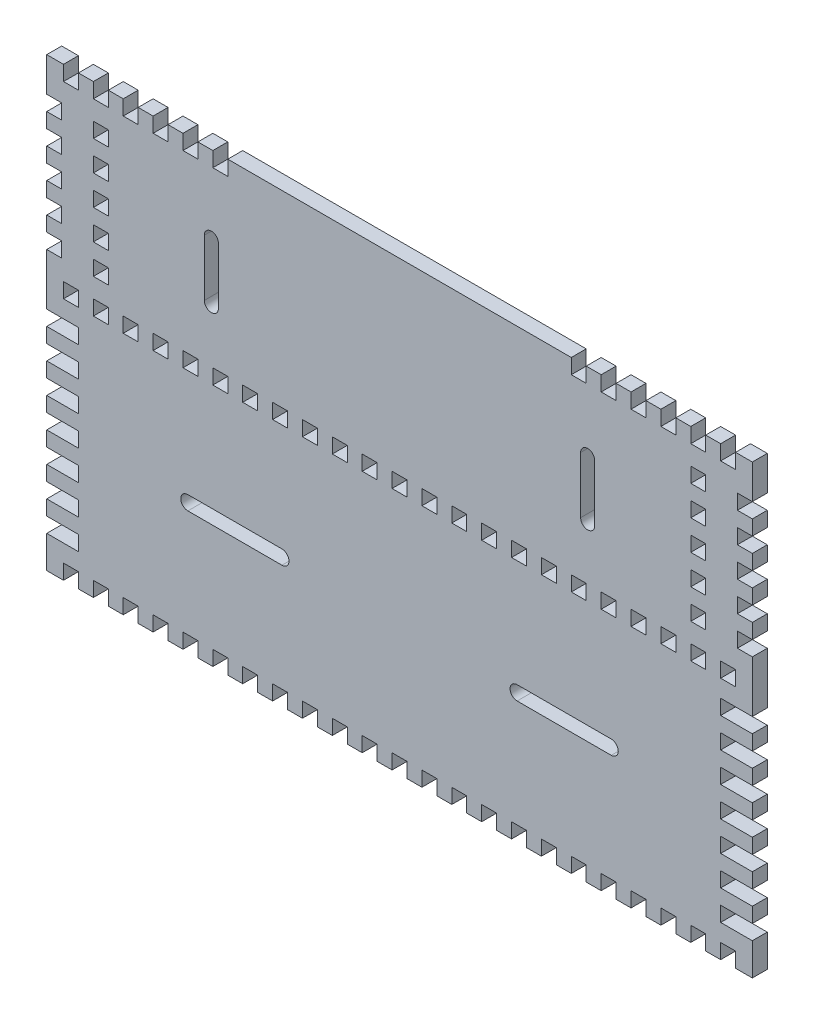
from build123d import *

# Parameters (mm, degrees)
SKETCH1_W                = 150
SKETCH1_H                = 55
BOSS_EXTRUDE1_DEPTH      = 3.175
CUT_EXTRUDE1_REACH       = 81.946
SKETCH2_W                = 3.175
SKETCH2_H                = 6.35
LPATTERN1_COUNT          = 12
LPATTERN1_PITCH          = 6.35
LPATTERN1_COL_COUNT      = 12
LPATTERN1_COL_PITCH      = 6.35
MIRROR1_COPY_1_REACH     = 81.946
MIRROR1_COPY_1_SKETCH_W  = 3.175
MIRROR1_COPY_1_SKETCH_H  = 6.35
MIRROR1_COPY_2_REACH     = 81.946
MIRROR1_COPY_2_SKETCH_W  = 3.175
MIRROR1_COPY_2_SKETCH_H  = 6.35
MIRROR1_COPY_3_REACH     = 81.946
MIRROR1_COPY_3_SKETCH_W  = 3.175
MIRROR1_COPY_3_SKETCH_H  = 6.35
MIRROR1_COPY_4_REACH     = 81.946
MIRROR1_COPY_4_SKETCH_W  = 3.175
MIRROR1_COPY_4_SKETCH_H  = 6.35
MIRROR1_COPY_5_REACH     = 81.946
MIRROR1_COPY_5_SKETCH_W  = 3.175
MIRROR1_COPY_5_SKETCH_H  = 6.35
MIRROR1_COPY_6_REACH     = 81.946
MIRROR1_COPY_6_SKETCH_W  = 3.175
MIRROR1_COPY_6_SKETCH_H  = 6.35
MIRROR1_COPY_7_REACH     = 81.946
MIRROR1_COPY_7_SKETCH_W  = 3.175
MIRROR1_COPY_7_SKETCH_H  = 6.35
MIRROR1_COPY_8_REACH     = 81.946
MIRROR1_COPY_8_SKETCH_W  = 3.175
MIRROR1_COPY_8_SKETCH_H  = 6.35
MIRROR1_COPY_9_REACH     = 81.946
MIRROR1_COPY_9_SKETCH_W  = 3.175
MIRROR1_COPY_9_SKETCH_H  = 6.35
MIRROR1_COPY_10_REACH    = 81.946
MIRROR1_COPY_10_SKETCH_W = 3.175
MIRROR1_COPY_10_SKETCH_H = 6.35
MIRROR1_COPY_11_REACH    = 81.946
MIRROR1_COPY_11_SKETCH_W = 3.175
MIRROR1_COPY_11_SKETCH_H = 6.35
MIRROR1_COPY_12_REACH    = 81.946
MIRROR1_COPY_12_SKETCH_W = 3.175
MIRROR1_COPY_12_SKETCH_H = 6.35
MIRROR1_COPY_13_REACH    = 81.946
MIRROR1_COPY_13_SKETCH_W = 3.175
MIRROR1_COPY_13_SKETCH_H = 6.35
MIRROR1_COPY_14_REACH    = 81.946
MIRROR1_COPY_14_SKETCH_W = 3.175
MIRROR1_COPY_14_SKETCH_H = 6.35
MIRROR1_COPY_15_REACH    = 81.946
MIRROR1_COPY_15_SKETCH_W = 3.175
MIRROR1_COPY_15_SKETCH_H = 6.35
MIRROR1_COPY_16_REACH    = 81.946
MIRROR1_COPY_16_SKETCH_W = 3.175
MIRROR1_COPY_16_SKETCH_H = 6.35
MIRROR1_COPY_17_REACH    = 81.946
MIRROR1_COPY_17_SKETCH_W = 3.175
MIRROR1_COPY_17_SKETCH_H = 6.35
MIRROR1_COPY_18_REACH    = 81.946
MIRROR1_COPY_18_SKETCH_W = 3.175
MIRROR1_COPY_18_SKETCH_H = 6.35
MIRROR1_COPY_19_REACH    = 81.946
MIRROR1_COPY_19_SKETCH_W = 3.175
MIRROR1_COPY_19_SKETCH_H = 6.35
MIRROR1_COPY_20_REACH    = 81.946
MIRROR1_COPY_20_SKETCH_W = 3.175
MIRROR1_COPY_20_SKETCH_H = 6.35
MIRROR1_COPY_21_REACH    = 81.946
MIRROR1_COPY_21_SKETCH_W = 3.175
MIRROR1_COPY_21_SKETCH_H = 6.35
MIRROR1_COPY_22_REACH    = 81.946
MIRROR1_COPY_22_SKETCH_W = 3.175
MIRROR1_COPY_22_SKETCH_H = 6.35
SKETCH5_W                = 6.35
SKETCH5_H                = 3.175
CUT_EXTRUDE3_DEPTH       = 10
LPATTERN2_COUNT          = 4
LPATTERN2_PITCH          = 6.35
LPATTERN2_COL_COUNT      = 4
LPATTERN2_COL_PITCH      = 6.35
MIRROR2_COPY_1_SKETCH_W  = 6.35
MIRROR2_COPY_1_SKETCH_H  = 3.175
MIRROR2_COPY_1_DEPTH     = 10
MIRROR2_COPY_2_SKETCH_W  = 6.35
MIRROR2_COPY_2_SKETCH_H  = 3.175
MIRROR2_COPY_2_DEPTH     = 10
MIRROR2_COPY_3_SKETCH_W  = 6.35
MIRROR2_COPY_3_SKETCH_H  = 3.175
MIRROR2_COPY_3_DEPTH     = 10
MIRROR2_COPY_4_SKETCH_W  = 6.35
MIRROR2_COPY_4_SKETCH_H  = 3.175
MIRROR2_COPY_4_DEPTH     = 10
MIRROR2_COPY_5_SKETCH_W  = 6.35
MIRROR2_COPY_5_SKETCH_H  = 3.175
MIRROR2_COPY_5_DEPTH     = 10
MIRROR2_COPY_6_SKETCH_W  = 6.35
MIRROR2_COPY_6_SKETCH_H  = 3.175
MIRROR2_COPY_6_DEPTH     = 10
SKETCH7_W                = 3.175
SKETCH7_H                = 3.175
CUT_EXTRUDE5_DEPTH       = 10
LPATTERN4_COUNT          = 7
LPATTERN4_PITCH          = 6.35
MIRROR3_COPY_1_SKETCH_W  = 3.175
MIRROR3_COPY_1_SKETCH_H  = 3.175
MIRROR3_COPY_1_DEPTH     = 10
MIRROR3_COPY_2_SKETCH_W  = 3.175
MIRROR3_COPY_2_SKETCH_H  = 3.175
MIRROR3_COPY_2_DEPTH     = 10
MIRROR3_COPY_3_SKETCH_W  = 3.175
MIRROR3_COPY_3_SKETCH_H  = 3.175
MIRROR3_COPY_3_DEPTH     = 10
MIRROR3_COPY_4_SKETCH_W  = 3.175
MIRROR3_COPY_4_SKETCH_H  = 3.175
MIRROR3_COPY_4_DEPTH     = 10
MIRROR3_COPY_5_SKETCH_W  = 3.175
MIRROR3_COPY_5_SKETCH_H  = 3.175
MIRROR3_COPY_5_DEPTH     = 10
MIRROR3_COPY_6_SKETCH_W  = 3.175
MIRROR3_COPY_6_SKETCH_H  = 3.175
MIRROR3_COPY_6_DEPTH     = 10
CUT_EXTRUDE6_DEPTH       = 10
SKETCH9_W                = 150
SKETCH9_H                = 40
BOSS_EXTRUDE2_DEPTH      = 3.175
CUT_EXTRUDE8_DEPTH       = 10
LPATTERN5_COUNT          = 12
LPATTERN5_PITCH          = 6.35
LPATTERN5_COL_COUNT      = 12
LPATTERN5_COL_PITCH      = 6.35
SKETCH12_W               = 73.025
SKETCH12_H               = 3.175
BOSS_EXTRUDE3_DEPTH      = 3.175
SKETCH14_W               = 6.35
SKETCH14_H               = 3.175
CUT_EXTRUDE9_DEPTH       = 10
LPATTERN6_COUNT          = 3
LPATTERN6_PITCH          = 6.35
LPATTERN6_COL_COUNT      = 3
LPATTERN6_COL_PITCH      = 6.35
MIRROR4_COPY_1_SKETCH_W  = 6.35
MIRROR4_COPY_1_SKETCH_H  = 3.175
MIRROR4_COPY_1_DEPTH     = 10
MIRROR4_COPY_2_SKETCH_W  = 6.35
MIRROR4_COPY_2_SKETCH_H  = 3.175
MIRROR4_COPY_2_DEPTH     = 10
MIRROR4_COPY_3_SKETCH_W  = 6.35
MIRROR4_COPY_3_SKETCH_H  = 3.175
MIRROR4_COPY_3_DEPTH     = 10
MIRROR4_COPY_4_SKETCH_W  = 6.35
MIRROR4_COPY_4_SKETCH_H  = 3.175
MIRROR4_COPY_4_DEPTH     = 10
SKETCH15_W               = 3.175
SKETCH15_H               = 3.175
CUT_EXTRUDE10_DEPTH      = 10
LPATTERN7_COUNT          = 3
LPATTERN7_PITCH          = 6.35
LPATTERN7_COL_COUNT      = 3
LPATTERN7_COL_PITCH      = 6.35
MIRROR5_COPY_1_SKETCH_W  = 3.175
MIRROR5_COPY_1_SKETCH_H  = 3.175
MIRROR5_COPY_1_DEPTH     = 10
MIRROR5_COPY_2_SKETCH_W  = 3.175
MIRROR5_COPY_2_SKETCH_H  = 3.175
MIRROR5_COPY_2_DEPTH     = 10
MIRROR5_COPY_3_SKETCH_W  = 3.175
MIRROR5_COPY_3_SKETCH_H  = 3.175
MIRROR5_COPY_3_DEPTH     = 10
MIRROR5_COPY_4_SKETCH_W  = 3.175
MIRROR5_COPY_4_SKETCH_H  = 3.175
MIRROR5_COPY_4_DEPTH     = 10
CUT_EXTRUDE12_DEPTH      = 10
SKETCH19_W               = 0.3875
SKETCH19_H               = 3.175
CUT_EXTRUDE13_DEPTH      = 10


with BuildPart() as part:
    # Sketch1 → Boss-Extrude1 (new body)
    with BuildSketch(Plane.XY):
        Rectangle(SKETCH1_W, SKETCH1_H)
    extrude(amount=BOSS_EXTRUDE1_DEPTH)

    # Sketch2 → Cut-Extrude1 (cut, up to next)
    with BuildSketch(Plane(origin=(0, 0, 0), x_dir=(-1, 0, 0), z_dir=(0, 0, -1)), mode=Mode.PRIVATE) as cut_extrude1_sk1:
        with Locations((0, 27.5)):
            Rectangle(SKETCH2_W, SKETCH2_H)
    cut_extrude1_tool1 = extrude(cut_extrude1_sk1.sketch, amount=-CUT_EXTRUDE1_REACH, mode=Mode.PRIVATE) & part.part
    cut_extrude1 = cut_extrude1_tool1.solids().sort_by_distance((0, 27.5, 0))[0]
    add(cut_extrude1, mode=Mode.SUBTRACT)

    # LPattern1: Cut-Extrude1 ×12
    with Locations(*[(i * LPATTERN1_PITCH, 0, 0) for i in range(1, LPATTERN1_COUNT)]):
        add(cut_extrude1, mode=Mode.SUBTRACT)

    # LPattern1 col: Cut-Extrude1 ×12
    with Locations(*[(-i * LPATTERN1_COL_PITCH, 0, 0) for i in range(1, LPATTERN1_COL_COUNT)]):
        add(cut_extrude1, mode=Mode.SUBTRACT)

    # Mirror1: Cut-Extrude1 across plane
    add(cut_extrude1.mirror(Plane.ZX), mode=Mode.SUBTRACT)

    # Mirror1 copy 1 sketch → Mirror1 copy 1 (cut, up to next)
    with BuildSketch(Plane(origin=(6.35, 0, 0), x_dir=(-1, 0, 0), z_dir=(0, 0, -1)), mode=Mode.PRIVATE) as mirror1_copy_1_sk1:
        with Locations((0, -27.5)):
            Rectangle(MIRROR1_COPY_1_SKETCH_W, MIRROR1_COPY_1_SKETCH_H)
    mirror1_copy_1_tool1 = extrude(mirror1_copy_1_sk1.sketch, amount=-MIRROR1_COPY_1_REACH, mode=Mode.PRIVATE) & part.part
    add(mirror1_copy_1_tool1.solids().sort_by_distance((6.35, -27.5, 0))[0], mode=Mode.SUBTRACT)

    # Mirror1 copy 2 sketch → Mirror1 copy 2 (cut, up to next)
    with BuildSketch(Plane(origin=(12.7, 0, 0), x_dir=(-1, 0, 0), z_dir=(0, 0, -1)), mode=Mode.PRIVATE) as mirror1_copy_2_sk1:
        with Locations((0, -27.5)):
            Rectangle(MIRROR1_COPY_2_SKETCH_W, MIRROR1_COPY_2_SKETCH_H)
    mirror1_copy_2_tool1 = extrude(mirror1_copy_2_sk1.sketch, amount=-MIRROR1_COPY_2_REACH, mode=Mode.PRIVATE) & part.part
    add(mirror1_copy_2_tool1.solids().sort_by_distance((12.7, -27.5, 0))[0], mode=Mode.SUBTRACT)

    # Mirror1 copy 3 sketch → Mirror1 copy 3 (cut, up to next)
    with BuildSketch(Plane(origin=(19.05, 0, 0), x_dir=(-1, 0, 0), z_dir=(0, 0, -1)), mode=Mode.PRIVATE) as mirror1_copy_3_sk1:
        with Locations((0, -27.5)):
            Rectangle(MIRROR1_COPY_3_SKETCH_W, MIRROR1_COPY_3_SKETCH_H)
    mirror1_copy_3_tool1 = extrude(mirror1_copy_3_sk1.sketch, amount=-MIRROR1_COPY_3_REACH, mode=Mode.PRIVATE) & part.part
    add(mirror1_copy_3_tool1.solids().sort_by_distance((19.05, -27.5, 0))[0], mode=Mode.SUBTRACT)

    # Mirror1 copy 4 sketch → Mirror1 copy 4 (cut, up to next)
    with BuildSketch(Plane(origin=(25.4, 0, 0), x_dir=(-1, 0, 0), z_dir=(0, 0, -1)), mode=Mode.PRIVATE) as mirror1_copy_4_sk1:
        with Locations((0, -27.5)):
            Rectangle(MIRROR1_COPY_4_SKETCH_W, MIRROR1_COPY_4_SKETCH_H)
    mirror1_copy_4_tool1 = extrude(mirror1_copy_4_sk1.sketch, amount=-MIRROR1_COPY_4_REACH, mode=Mode.PRIVATE) & part.part
    add(mirror1_copy_4_tool1.solids().sort_by_distance((25.4, -27.5, 0))[0], mode=Mode.SUBTRACT)

    # Mirror1 copy 5 sketch → Mirror1 copy 5 (cut, up to next)
    with BuildSketch(Plane(origin=(31.75, 0, 0), x_dir=(-1, 0, 0), z_dir=(0, 0, -1)), mode=Mode.PRIVATE) as mirror1_copy_5_sk1:
        with Locations((0, -27.5)):
            Rectangle(MIRROR1_COPY_5_SKETCH_W, MIRROR1_COPY_5_SKETCH_H)
    mirror1_copy_5_tool1 = extrude(mirror1_copy_5_sk1.sketch, amount=-MIRROR1_COPY_5_REACH, mode=Mode.PRIVATE) & part.part
    add(mirror1_copy_5_tool1.solids().sort_by_distance((31.75, -27.5, 0))[0], mode=Mode.SUBTRACT)

    # Mirror1 copy 6 sketch → Mirror1 copy 6 (cut, up to next)
    with BuildSketch(Plane(origin=(38.1, 0, 0), x_dir=(-1, 0, 0), z_dir=(0, 0, -1)), mode=Mode.PRIVATE) as mirror1_copy_6_sk1:
        with Locations((0, -27.5)):
            Rectangle(MIRROR1_COPY_6_SKETCH_W, MIRROR1_COPY_6_SKETCH_H)
    mirror1_copy_6_tool1 = extrude(mirror1_copy_6_sk1.sketch, amount=-MIRROR1_COPY_6_REACH, mode=Mode.PRIVATE) & part.part
    add(mirror1_copy_6_tool1.solids().sort_by_distance((38.1, -27.5, 0))[0], mode=Mode.SUBTRACT)

    # Mirror1 copy 7 sketch → Mirror1 copy 7 (cut, up to next)
    with BuildSketch(Plane(origin=(44.45, 0, 0), x_dir=(-1, 0, 0), z_dir=(0, 0, -1)), mode=Mode.PRIVATE) as mirror1_copy_7_sk1:
        with Locations((0, -27.5)):
            Rectangle(MIRROR1_COPY_7_SKETCH_W, MIRROR1_COPY_7_SKETCH_H)
    mirror1_copy_7_tool1 = extrude(mirror1_copy_7_sk1.sketch, amount=-MIRROR1_COPY_7_REACH, mode=Mode.PRIVATE) & part.part
    add(mirror1_copy_7_tool1.solids().sort_by_distance((44.45, -27.5, 0))[0], mode=Mode.SUBTRACT)

    # Mirror1 copy 8 sketch → Mirror1 copy 8 (cut, up to next)
    with BuildSketch(Plane(origin=(50.8, 0, 0), x_dir=(-1, 0, 0), z_dir=(0, 0, -1)), mode=Mode.PRIVATE) as mirror1_copy_8_sk1:
        with Locations((0, -27.5)):
            Rectangle(MIRROR1_COPY_8_SKETCH_W, MIRROR1_COPY_8_SKETCH_H)
    mirror1_copy_8_tool1 = extrude(mirror1_copy_8_sk1.sketch, amount=-MIRROR1_COPY_8_REACH, mode=Mode.PRIVATE) & part.part
    add(mirror1_copy_8_tool1.solids().sort_by_distance((50.8, -27.5, 0))[0], mode=Mode.SUBTRACT)

    # Mirror1 copy 9 sketch → Mirror1 copy 9 (cut, up to next)
    with BuildSketch(Plane(origin=(57.15, 0, 0), x_dir=(-1, 0, 0), z_dir=(0, 0, -1)), mode=Mode.PRIVATE) as mirror1_copy_9_sk1:
        with Locations((0, -27.5)):
            Rectangle(MIRROR1_COPY_9_SKETCH_W, MIRROR1_COPY_9_SKETCH_H)
    mirror1_copy_9_tool1 = extrude(mirror1_copy_9_sk1.sketch, amount=-MIRROR1_COPY_9_REACH, mode=Mode.PRIVATE) & part.part
    add(mirror1_copy_9_tool1.solids().sort_by_distance((57.15, -27.5, 0))[0], mode=Mode.SUBTRACT)

    # Mirror1 copy 10 sketch → Mirror1 copy 10 (cut, up to next)
    with BuildSketch(Plane(origin=(63.5, 0, 0), x_dir=(-1, 0, 0), z_dir=(0, 0, -1)), mode=Mode.PRIVATE) as mirror1_copy_10_sk1:
        with Locations((0, -27.5)):
            Rectangle(MIRROR1_COPY_10_SKETCH_W, MIRROR1_COPY_10_SKETCH_H)
    mirror1_copy_10_tool1 = extrude(mirror1_copy_10_sk1.sketch, amount=-MIRROR1_COPY_10_REACH, mode=Mode.PRIVATE) & part.part
    add(mirror1_copy_10_tool1.solids().sort_by_distance((63.5, -27.5, 0))[0], mode=Mode.SUBTRACT)

    # Mirror1 copy 11 sketch → Mirror1 copy 11 (cut, up to next)
    with BuildSketch(Plane(origin=(69.85, 0, 0), x_dir=(-1, 0, 0), z_dir=(0, 0, -1)), mode=Mode.PRIVATE) as mirror1_copy_11_sk1:
        with Locations((0, -27.5)):
            Rectangle(MIRROR1_COPY_11_SKETCH_W, MIRROR1_COPY_11_SKETCH_H)
    mirror1_copy_11_tool1 = extrude(mirror1_copy_11_sk1.sketch, amount=-MIRROR1_COPY_11_REACH, mode=Mode.PRIVATE) & part.part
    add(mirror1_copy_11_tool1.solids().sort_by_distance((69.85, -27.5, 0))[0], mode=Mode.SUBTRACT)

    # Mirror1 copy 12 sketch → Mirror1 copy 12 (cut, up to next)
    with BuildSketch(Plane(origin=(-6.35, 0, 0), x_dir=(-1, 0, 0), z_dir=(0, 0, -1)), mode=Mode.PRIVATE) as mirror1_copy_12_sk1:
        with Locations((0, -27.5)):
            Rectangle(MIRROR1_COPY_12_SKETCH_W, MIRROR1_COPY_12_SKETCH_H)
    mirror1_copy_12_tool1 = extrude(mirror1_copy_12_sk1.sketch, amount=-MIRROR1_COPY_12_REACH, mode=Mode.PRIVATE) & part.part
    add(mirror1_copy_12_tool1.solids().sort_by_distance((-6.35, -27.5, 0))[0], mode=Mode.SUBTRACT)

    # Mirror1 copy 13 sketch → Mirror1 copy 13 (cut, up to next)
    with BuildSketch(Plane(origin=(-12.7, 0, 0), x_dir=(-1, 0, 0), z_dir=(0, 0, -1)), mode=Mode.PRIVATE) as mirror1_copy_13_sk1:
        with Locations((0, -27.5)):
            Rectangle(MIRROR1_COPY_13_SKETCH_W, MIRROR1_COPY_13_SKETCH_H)
    mirror1_copy_13_tool1 = extrude(mirror1_copy_13_sk1.sketch, amount=-MIRROR1_COPY_13_REACH, mode=Mode.PRIVATE) & part.part
    add(mirror1_copy_13_tool1.solids().sort_by_distance((-12.7, -27.5, 0))[0], mode=Mode.SUBTRACT)

    # Mirror1 copy 14 sketch → Mirror1 copy 14 (cut, up to next)
    with BuildSketch(Plane(origin=(-19.05, 0, 0), x_dir=(-1, 0, 0), z_dir=(0, 0, -1)), mode=Mode.PRIVATE) as mirror1_copy_14_sk1:
        with Locations((0, -27.5)):
            Rectangle(MIRROR1_COPY_14_SKETCH_W, MIRROR1_COPY_14_SKETCH_H)
    mirror1_copy_14_tool1 = extrude(mirror1_copy_14_sk1.sketch, amount=-MIRROR1_COPY_14_REACH, mode=Mode.PRIVATE) & part.part
    add(mirror1_copy_14_tool1.solids().sort_by_distance((-19.05, -27.5, 0))[0], mode=Mode.SUBTRACT)

    # Mirror1 copy 15 sketch → Mirror1 copy 15 (cut, up to next)
    with BuildSketch(Plane(origin=(-25.4, 0, 0), x_dir=(-1, 0, 0), z_dir=(0, 0, -1)), mode=Mode.PRIVATE) as mirror1_copy_15_sk1:
        with Locations((0, -27.5)):
            Rectangle(MIRROR1_COPY_15_SKETCH_W, MIRROR1_COPY_15_SKETCH_H)
    mirror1_copy_15_tool1 = extrude(mirror1_copy_15_sk1.sketch, amount=-MIRROR1_COPY_15_REACH, mode=Mode.PRIVATE) & part.part
    add(mirror1_copy_15_tool1.solids().sort_by_distance((-25.4, -27.5, 0))[0], mode=Mode.SUBTRACT)

    # Mirror1 copy 16 sketch → Mirror1 copy 16 (cut, up to next)
    with BuildSketch(Plane(origin=(-31.75, 0, 0), x_dir=(-1, 0, 0), z_dir=(0, 0, -1)), mode=Mode.PRIVATE) as mirror1_copy_16_sk1:
        with Locations((0, -27.5)):
            Rectangle(MIRROR1_COPY_16_SKETCH_W, MIRROR1_COPY_16_SKETCH_H)
    mirror1_copy_16_tool1 = extrude(mirror1_copy_16_sk1.sketch, amount=-MIRROR1_COPY_16_REACH, mode=Mode.PRIVATE) & part.part
    add(mirror1_copy_16_tool1.solids().sort_by_distance((-31.75, -27.5, 0))[0], mode=Mode.SUBTRACT)

    # Mirror1 copy 17 sketch → Mirror1 copy 17 (cut, up to next)
    with BuildSketch(Plane(origin=(-38.1, 0, 0), x_dir=(-1, 0, 0), z_dir=(0, 0, -1)), mode=Mode.PRIVATE) as mirror1_copy_17_sk1:
        with Locations((0, -27.5)):
            Rectangle(MIRROR1_COPY_17_SKETCH_W, MIRROR1_COPY_17_SKETCH_H)
    mirror1_copy_17_tool1 = extrude(mirror1_copy_17_sk1.sketch, amount=-MIRROR1_COPY_17_REACH, mode=Mode.PRIVATE) & part.part
    add(mirror1_copy_17_tool1.solids().sort_by_distance((-38.1, -27.5, 0))[0], mode=Mode.SUBTRACT)

    # Mirror1 copy 18 sketch → Mirror1 copy 18 (cut, up to next)
    with BuildSketch(Plane(origin=(-44.45, 0, 0), x_dir=(-1, 0, 0), z_dir=(0, 0, -1)), mode=Mode.PRIVATE) as mirror1_copy_18_sk1:
        with Locations((0, -27.5)):
            Rectangle(MIRROR1_COPY_18_SKETCH_W, MIRROR1_COPY_18_SKETCH_H)
    mirror1_copy_18_tool1 = extrude(mirror1_copy_18_sk1.sketch, amount=-MIRROR1_COPY_18_REACH, mode=Mode.PRIVATE) & part.part
    add(mirror1_copy_18_tool1.solids().sort_by_distance((-44.45, -27.5, 0))[0], mode=Mode.SUBTRACT)

    # Mirror1 copy 19 sketch → Mirror1 copy 19 (cut, up to next)
    with BuildSketch(Plane(origin=(-50.8, 0, 0), x_dir=(-1, 0, 0), z_dir=(0, 0, -1)), mode=Mode.PRIVATE) as mirror1_copy_19_sk1:
        with Locations((0, -27.5)):
            Rectangle(MIRROR1_COPY_19_SKETCH_W, MIRROR1_COPY_19_SKETCH_H)
    mirror1_copy_19_tool1 = extrude(mirror1_copy_19_sk1.sketch, amount=-MIRROR1_COPY_19_REACH, mode=Mode.PRIVATE) & part.part
    add(mirror1_copy_19_tool1.solids().sort_by_distance((-50.8, -27.5, 0))[0], mode=Mode.SUBTRACT)

    # Mirror1 copy 20 sketch → Mirror1 copy 20 (cut, up to next)
    with BuildSketch(Plane(origin=(-57.15, 0, 0), x_dir=(-1, 0, 0), z_dir=(0, 0, -1)), mode=Mode.PRIVATE) as mirror1_copy_20_sk1:
        with Locations((0, -27.5)):
            Rectangle(MIRROR1_COPY_20_SKETCH_W, MIRROR1_COPY_20_SKETCH_H)
    mirror1_copy_20_tool1 = extrude(mirror1_copy_20_sk1.sketch, amount=-MIRROR1_COPY_20_REACH, mode=Mode.PRIVATE) & part.part
    add(mirror1_copy_20_tool1.solids().sort_by_distance((-57.15, -27.5, 0))[0], mode=Mode.SUBTRACT)

    # Mirror1 copy 21 sketch → Mirror1 copy 21 (cut, up to next)
    with BuildSketch(Plane(origin=(-63.5, 0, 0), x_dir=(-1, 0, 0), z_dir=(0, 0, -1)), mode=Mode.PRIVATE) as mirror1_copy_21_sk1:
        with Locations((0, -27.5)):
            Rectangle(MIRROR1_COPY_21_SKETCH_W, MIRROR1_COPY_21_SKETCH_H)
    mirror1_copy_21_tool1 = extrude(mirror1_copy_21_sk1.sketch, amount=-MIRROR1_COPY_21_REACH, mode=Mode.PRIVATE) & part.part
    add(mirror1_copy_21_tool1.solids().sort_by_distance((-63.5, -27.5, 0))[0], mode=Mode.SUBTRACT)

    # Mirror1 copy 22 sketch → Mirror1 copy 22 (cut, up to next)
    with BuildSketch(Plane(origin=(-69.85, 0, 0), x_dir=(-1, 0, 0), z_dir=(0, 0, -1)), mode=Mode.PRIVATE) as mirror1_copy_22_sk1:
        with Locations((0, -27.5)):
            Rectangle(MIRROR1_COPY_22_SKETCH_W, MIRROR1_COPY_22_SKETCH_H)
    mirror1_copy_22_tool1 = extrude(mirror1_copy_22_sk1.sketch, amount=-MIRROR1_COPY_22_REACH, mode=Mode.PRIVATE) & part.part
    add(mirror1_copy_22_tool1.solids().sort_by_distance((-69.85, -27.5, 0))[0], mode=Mode.SUBTRACT)

    # Sketch5 → Cut-Extrude3 (cut)
    with BuildSketch(Plane.XY.offset(3.175)):
        with Locations((-75, 0)):
            Rectangle(SKETCH5_W, SKETCH5_H)
    cut_extrude3 = extrude(amount=-CUT_EXTRUDE3_DEPTH, mode=Mode.SUBTRACT)

    # LPattern2: Cut-Extrude3 ×4
    with Locations(*[(0, i * LPATTERN2_PITCH, 0) for i in range(1, LPATTERN2_COUNT)]):
        add(cut_extrude3, mode=Mode.SUBTRACT)

    # LPattern2 col: Cut-Extrude3 ×4
    with Locations(*[(0, -i * LPATTERN2_COL_PITCH, 0) for i in range(1, LPATTERN2_COL_COUNT)]):
        add(cut_extrude3, mode=Mode.SUBTRACT)

    # Mirror2: Cut-Extrude3 across plane
    add(cut_extrude3.mirror(Plane(origin=(0, 0, 0), x_dir=(0, 0, 1), z_dir=(1, 0, 0))), mode=Mode.SUBTRACT)

    # Mirror2 copy 1 sketch → Mirror2 copy 1 (cut)
    with BuildSketch(Plane(origin=(0, 6.35, 3.175), x_dir=(-1, 0, 0), z_dir=(0, 0, 1))):
        with Locations((-75, 0)):
            Rectangle(MIRROR2_COPY_1_SKETCH_W, MIRROR2_COPY_1_SKETCH_H)
    extrude(amount=-MIRROR2_COPY_1_DEPTH, mode=Mode.SUBTRACT)

    # Mirror2 copy 2 sketch → Mirror2 copy 2 (cut)
    with BuildSketch(Plane(origin=(0, 12.7, 3.175), x_dir=(-1, 0, 0), z_dir=(0, 0, 1))):
        with Locations((-75, 0)):
            Rectangle(MIRROR2_COPY_2_SKETCH_W, MIRROR2_COPY_2_SKETCH_H)
    extrude(amount=-MIRROR2_COPY_2_DEPTH, mode=Mode.SUBTRACT)

    # Mirror2 copy 3 sketch → Mirror2 copy 3 (cut)
    with BuildSketch(Plane(origin=(0, 19.05, 3.175), x_dir=(-1, 0, 0), z_dir=(0, 0, 1))):
        with Locations((-75, 0)):
            Rectangle(MIRROR2_COPY_3_SKETCH_W, MIRROR2_COPY_3_SKETCH_H)
    extrude(amount=-MIRROR2_COPY_3_DEPTH, mode=Mode.SUBTRACT)

    # Mirror2 copy 4 sketch → Mirror2 copy 4 (cut)
    with BuildSketch(Plane(origin=(0, -6.35, 3.175), x_dir=(-1, 0, 0), z_dir=(0, 0, 1))):
        with Locations((-75, 0)):
            Rectangle(MIRROR2_COPY_4_SKETCH_W, MIRROR2_COPY_4_SKETCH_H)
    extrude(amount=-MIRROR2_COPY_4_DEPTH, mode=Mode.SUBTRACT)

    # Mirror2 copy 5 sketch → Mirror2 copy 5 (cut)
    with BuildSketch(Plane(origin=(0, -12.7, 3.175), x_dir=(-1, 0, 0), z_dir=(0, 0, 1))):
        with Locations((-75, 0)):
            Rectangle(MIRROR2_COPY_5_SKETCH_W, MIRROR2_COPY_5_SKETCH_H)
    extrude(amount=-MIRROR2_COPY_5_DEPTH, mode=Mode.SUBTRACT)

    # Mirror2 copy 6 sketch → Mirror2 copy 6 (cut)
    with BuildSketch(Plane(origin=(0, -19.05, 3.175), x_dir=(-1, 0, 0), z_dir=(0, 0, 1))):
        with Locations((-75, 0)):
            Rectangle(MIRROR2_COPY_6_SKETCH_W, MIRROR2_COPY_6_SKETCH_H)
    extrude(amount=-MIRROR2_COPY_6_DEPTH, mode=Mode.SUBTRACT)

    # Sketch7 → Cut-Extrude5 (cut)
    with BuildSketch(Plane(origin=(0, 0, 0), x_dir=(-1, 0, 0), z_dir=(0, 0, -1))):
        with Locations((-70.2375, 19.05)):
            Rectangle(SKETCH7_W, SKETCH7_H)
    cut_extrude5 = extrude(amount=-CUT_EXTRUDE5_DEPTH, mode=Mode.SUBTRACT)

    # LPattern4: Cut-Extrude5 ×7
    with Locations(*[(0, -i * LPATTERN4_PITCH, 0) for i in range(1, LPATTERN4_COUNT)]):
        add(cut_extrude5, mode=Mode.SUBTRACT)

    # Mirror3: Cut-Extrude5 across plane
    add(cut_extrude5.mirror(Plane(origin=(0, 0, 0), x_dir=(0, 0, 1), z_dir=(1, 0, 0))), mode=Mode.SUBTRACT)

    # Mirror3 copy 1 sketch → Mirror3 copy 1 (cut)
    with BuildSketch(Plane(origin=(0, -6.35, 0), x_dir=(1, 0, 0), z_dir=(0, 0, -1))):
        with Locations((-70.2375, -19.05)):
            Rectangle(MIRROR3_COPY_1_SKETCH_W, MIRROR3_COPY_1_SKETCH_H)
    extrude(amount=-MIRROR3_COPY_1_DEPTH, mode=Mode.SUBTRACT)

    # Mirror3 copy 2 sketch → Mirror3 copy 2 (cut)
    with BuildSketch(Plane(origin=(0, -12.7, 0), x_dir=(1, 0, 0), z_dir=(0, 0, -1))):
        with Locations((-70.2375, -19.05)):
            Rectangle(MIRROR3_COPY_2_SKETCH_W, MIRROR3_COPY_2_SKETCH_H)
    extrude(amount=-MIRROR3_COPY_2_DEPTH, mode=Mode.SUBTRACT)

    # Mirror3 copy 3 sketch → Mirror3 copy 3 (cut)
    with BuildSketch(Plane(origin=(0, -19.05, 0), x_dir=(1, 0, 0), z_dir=(0, 0, -1))):
        with Locations((-70.2375, -19.05)):
            Rectangle(MIRROR3_COPY_3_SKETCH_W, MIRROR3_COPY_3_SKETCH_H)
    extrude(amount=-MIRROR3_COPY_3_DEPTH, mode=Mode.SUBTRACT)

    # Mirror3 copy 4 sketch → Mirror3 copy 4 (cut)
    with BuildSketch(Plane(origin=(0, -25.4, 0), x_dir=(1, 0, 0), z_dir=(0, 0, -1))):
        with Locations((-70.2375, -19.05)):
            Rectangle(MIRROR3_COPY_4_SKETCH_W, MIRROR3_COPY_4_SKETCH_H)
    extrude(amount=-MIRROR3_COPY_4_DEPTH, mode=Mode.SUBTRACT)

    # Mirror3 copy 5 sketch → Mirror3 copy 5 (cut)
    with BuildSketch(Plane(origin=(0, -31.75, 0), x_dir=(1, 0, 0), z_dir=(0, 0, -1))):
        with Locations((-70.2375, -19.05)):
            Rectangle(MIRROR3_COPY_5_SKETCH_W, MIRROR3_COPY_5_SKETCH_H)
    extrude(amount=-MIRROR3_COPY_5_DEPTH, mode=Mode.SUBTRACT)

    # Mirror3 copy 6 sketch → Mirror3 copy 6 (cut)
    with BuildSketch(Plane(origin=(0, -38.1, 0), x_dir=(1, 0, 0), z_dir=(0, 0, -1))):
        with Locations((-70.2375, -19.05)):
            Rectangle(MIRROR3_COPY_6_SKETCH_W, MIRROR3_COPY_6_SKETCH_H)
    extrude(amount=-MIRROR3_COPY_6_DEPTH, mode=Mode.SUBTRACT)

    # Sketch8 → Cut-Extrude6 (cut)
    with BuildSketch(Plane(origin=(0, 0, 0), x_dir=(-1, 0, 0), z_dir=(0, 0, -1))):
        with BuildLine():
            Line((-25, -1.5), (-45, -1.5))
            ThreePointArc((-45, -1.5), (-46.5, 0), (-45, 1.5))
            Line((-45, 1.5), (-25, 1.5))
            ThreePointArc((-25, 1.5), (-23.5, 0), (-25, -1.5))
        make_face()
        with BuildLine():
            Line((45, -1.5), (25, -1.5))
            ThreePointArc((25, -1.5), (23.5, 0), (25, 1.5))
            Line((25, 1.5), (45, 1.5))
            ThreePointArc((45, 1.5), (46.5, 0), (45, -1.5))
        make_face()
    extrude(amount=-CUT_EXTRUDE6_DEPTH, mode=Mode.SUBTRACT)

    # Sketch9 → Boss-Extrude2 (add)
    with BuildSketch(Plane(origin=(0, 0, 0), x_dir=(-1, 0, 0), z_dir=(0, 0, -1))):
        with Locations((0, 47.5)):
            Rectangle(SKETCH9_W, SKETCH9_H)
    extrude(amount=-BOSS_EXTRUDE2_DEPTH)

    # Sketch11 → Cut-Extrude8 (cut)
    with BuildSketch(Plane(origin=(0, 0, 0), x_dir=(-1, 0, 0), z_dir=(0, 0, -1))):
        Polygon((0, 67.5), (1.5875, 67.5), (1.5875, 64.325), (0, 64.325), (-1.5875, 64.325), (-1.5875, 67.5), align=None)
    cut_extrude8 = extrude(amount=-CUT_EXTRUDE8_DEPTH, mode=Mode.SUBTRACT)

    # LPattern5: Cut-Extrude8 ×12
    with Locations(*[(i * LPATTERN5_PITCH, 0, 0) for i in range(1, LPATTERN5_COUNT)]):
        add(cut_extrude8, mode=Mode.SUBTRACT)

    # LPattern5 col: Cut-Extrude8 ×12
    with Locations(*[(-i * LPATTERN5_COL_PITCH, 0, 0) for i in range(1, LPATTERN5_COL_COUNT)]):
        add(cut_extrude8, mode=Mode.SUBTRACT)

    # Sketch12 → Boss-Extrude3 (add)
    with BuildSketch(Plane(origin=(0, 0, 0), x_dir=(-1, 0, 0), z_dir=(0, 0, -1))):
        with Locations((0, 65.9125)):
            Rectangle(SKETCH12_W, SKETCH12_H)
    extrude(amount=-BOSS_EXTRUDE3_DEPTH)

    # Sketch14 → Cut-Extrude9 (cut)
    with BuildSketch(Plane(origin=(0, 0, 0), x_dir=(-1, 0, 0), z_dir=(0, 0, -1))):
        with Locations((-75, 45.9125)):
            Rectangle(SKETCH14_W, SKETCH14_H)
    cut_extrude9 = extrude(amount=-CUT_EXTRUDE9_DEPTH, mode=Mode.SUBTRACT)

    # LPattern6: Cut-Extrude9 ×3
    with Locations(*[(0, i * LPATTERN6_PITCH, 0) for i in range(1, LPATTERN6_COUNT)]):
        add(cut_extrude9, mode=Mode.SUBTRACT)

    # LPattern6 col: Cut-Extrude9 ×3
    with Locations(*[(0, -i * LPATTERN6_COL_PITCH, 0) for i in range(1, LPATTERN6_COL_COUNT)]):
        add(cut_extrude9, mode=Mode.SUBTRACT)

    # Mirror4: Cut-Extrude9 across plane
    add(cut_extrude9.mirror(Plane(origin=(0, 0, 0), x_dir=(0, 0, 1), z_dir=(1, 0, 0))), mode=Mode.SUBTRACT)

    # Mirror4 copy 1 sketch → Mirror4 copy 1 (cut)
    with BuildSketch(Plane(origin=(0, 6.35, 0), x_dir=(1, 0, 0), z_dir=(0, 0, -1))):
        with Locations((-75, -45.9125)):
            Rectangle(MIRROR4_COPY_1_SKETCH_W, MIRROR4_COPY_1_SKETCH_H)
    extrude(amount=-MIRROR4_COPY_1_DEPTH, mode=Mode.SUBTRACT)

    # Mirror4 copy 2 sketch → Mirror4 copy 2 (cut)
    with BuildSketch(Plane(origin=(0, 12.7, 0), x_dir=(1, 0, 0), z_dir=(0, 0, -1))):
        with Locations((-75, -45.9125)):
            Rectangle(MIRROR4_COPY_2_SKETCH_W, MIRROR4_COPY_2_SKETCH_H)
    extrude(amount=-MIRROR4_COPY_2_DEPTH, mode=Mode.SUBTRACT)

    # Mirror4 copy 3 sketch → Mirror4 copy 3 (cut)
    with BuildSketch(Plane(origin=(0, -6.35, 0), x_dir=(1, 0, 0), z_dir=(0, 0, -1))):
        with Locations((-75, -45.9125)):
            Rectangle(MIRROR4_COPY_3_SKETCH_W, MIRROR4_COPY_3_SKETCH_H)
    extrude(amount=-MIRROR4_COPY_3_DEPTH, mode=Mode.SUBTRACT)

    # Mirror4 copy 4 sketch → Mirror4 copy 4 (cut)
    with BuildSketch(Plane(origin=(0, -12.7, 0), x_dir=(1, 0, 0), z_dir=(0, 0, -1))):
        with Locations((-75, -45.9125)):
            Rectangle(MIRROR4_COPY_4_SKETCH_W, MIRROR4_COPY_4_SKETCH_H)
    extrude(amount=-MIRROR4_COPY_4_DEPTH, mode=Mode.SUBTRACT)

    # Sketch15 → Cut-Extrude10 (cut)
    with BuildSketch(Plane(origin=(0, 0, 0), x_dir=(-1, 0, 0), z_dir=(0, 0, -1))):
        with Locations((-63.5, 45.9125)):
            Rectangle(SKETCH15_W, SKETCH15_H)
    cut_extrude10 = extrude(amount=-CUT_EXTRUDE10_DEPTH, mode=Mode.SUBTRACT)

    # LPattern7: Cut-Extrude10 ×3
    with Locations(*[(0, i * LPATTERN7_PITCH, 0) for i in range(1, LPATTERN7_COUNT)]):
        add(cut_extrude10, mode=Mode.SUBTRACT)

    # LPattern7 col: Cut-Extrude10 ×3
    with Locations(*[(0, -i * LPATTERN7_COL_PITCH, 0) for i in range(1, LPATTERN7_COL_COUNT)]):
        add(cut_extrude10, mode=Mode.SUBTRACT)

    # Mirror5: Cut-Extrude10 across plane
    add(cut_extrude10.mirror(Plane(origin=(0, 0, 0), x_dir=(0, 0, 1), z_dir=(1, 0, 0))), mode=Mode.SUBTRACT)

    # Mirror5 copy 1 sketch → Mirror5 copy 1 (cut)
    with BuildSketch(Plane(origin=(0, 6.35, 0), x_dir=(1, 0, 0), z_dir=(0, 0, -1))):
        with Locations((-63.5, -45.9125)):
            Rectangle(MIRROR5_COPY_1_SKETCH_W, MIRROR5_COPY_1_SKETCH_H)
    extrude(amount=-MIRROR5_COPY_1_DEPTH, mode=Mode.SUBTRACT)

    # Mirror5 copy 2 sketch → Mirror5 copy 2 (cut)
    with BuildSketch(Plane(origin=(0, 12.7, 0), x_dir=(1, 0, 0), z_dir=(0, 0, -1))):
        with Locations((-63.5, -45.9125)):
            Rectangle(MIRROR5_COPY_2_SKETCH_W, MIRROR5_COPY_2_SKETCH_H)
    extrude(amount=-MIRROR5_COPY_2_DEPTH, mode=Mode.SUBTRACT)

    # Mirror5 copy 3 sketch → Mirror5 copy 3 (cut)
    with BuildSketch(Plane(origin=(0, -6.35, 0), x_dir=(1, 0, 0), z_dir=(0, 0, -1))):
        with Locations((-63.5, -45.9125)):
            Rectangle(MIRROR5_COPY_3_SKETCH_W, MIRROR5_COPY_3_SKETCH_H)
    extrude(amount=-MIRROR5_COPY_3_DEPTH, mode=Mode.SUBTRACT)

    # Mirror5 copy 4 sketch → Mirror5 copy 4 (cut)
    with BuildSketch(Plane(origin=(0, -12.7, 0), x_dir=(1, 0, 0), z_dir=(0, 0, -1))):
        with Locations((-63.5, -45.9125)):
            Rectangle(MIRROR5_COPY_4_SKETCH_W, MIRROR5_COPY_4_SKETCH_H)
    extrude(amount=-MIRROR5_COPY_4_DEPTH, mode=Mode.SUBTRACT)

    # Sketch17 → Cut-Extrude12 (cut)
    with BuildSketch(Plane(origin=(0, 0, 0), x_dir=(-1, 0, 0), z_dir=(0, 0, -1))):
        with BuildLine():
            Line((-38.5, 51), (-38.5, 39))
            ThreePointArc((-38.5, 39), (-40, 37.5), (-41.5, 39))
            Line((-41.5, 39), (-41.5, 51))
            ThreePointArc((-41.5, 51), (-40, 52.5), (-38.5, 51))
        make_face()
    cut_extrude12 = extrude(amount=-CUT_EXTRUDE12_DEPTH, mode=Mode.SUBTRACT)

    # Mirror6: Cut-Extrude12 across plane
    add(cut_extrude12.mirror(Plane(origin=(0, 0, 0), x_dir=(0, 0, 1), z_dir=(1, 0, 0))), mode=Mode.SUBTRACT)

    # Sketch19 → Cut-Extrude13 (cut)
    with BuildSketch(Plane(origin=(0, 0, 0), x_dir=(-1, 0, 0), z_dir=(0, 0, -1))):
        with Locations((68.45625, -19.05)):
            Rectangle(SKETCH19_W, SKETCH19_H)
        with Locations((68.45625, -12.7)):
            Rectangle(SKETCH19_W, SKETCH19_H)
        with Locations((68.45625, -6.35)):
            Rectangle(SKETCH19_W, SKETCH19_H)
        with Locations((68.45625, 0)):
            Rectangle(SKETCH19_W, SKETCH19_H)
        with Locations((68.45625, 6.35)):
            Rectangle(SKETCH19_W, SKETCH19_H)
        with Locations((68.45625, 12.7)):
            Rectangle(SKETCH19_W, SKETCH19_H)
        with Locations((68.45625, 19.05)):
            Rectangle(SKETCH19_W, SKETCH19_H)
    cut_extrude13 = extrude(amount=-CUT_EXTRUDE13_DEPTH, mode=Mode.SUBTRACT)

    # Mirror7: Cut-Extrude13 across plane
    add(cut_extrude13.mirror(Plane(origin=(0, 0, 0), x_dir=(0, 0, 1), z_dir=(1, 0, 0))), mode=Mode.SUBTRACT)


solid = part.part
